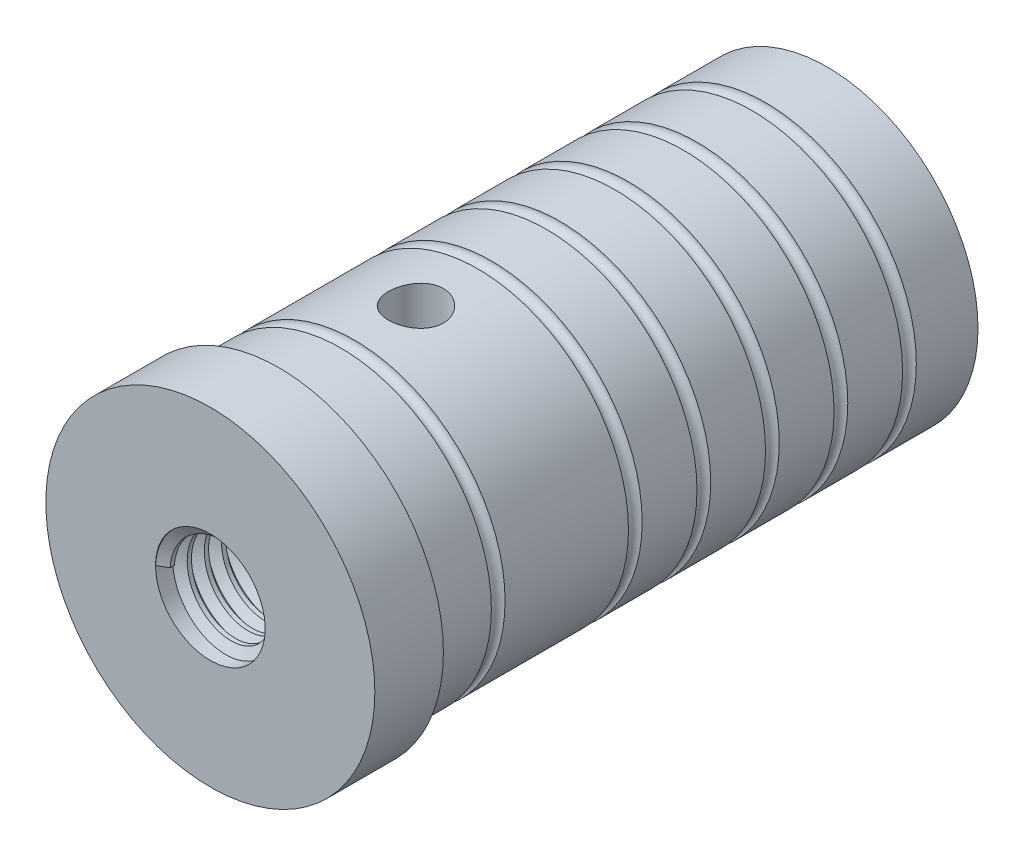
from build123d import *
from build123d.topology import SkipClean

# Parameters (mm, degrees)
IZIM1_R                     = 11
IZIM1_R_2                   = 8
Y_KSEKLIK_EKSTR_ZYON1_DEPTH = 25
IZIM2_R                     = 11
Y_KSEKLIK_EKSTR_ZYON2_DEPTH = 15
IZIM3_R                     = 12
Y_KSEKLIK_EKSTR_ZYON3_DEPTH = 5
IZIM4_R                     = 4
KES_EKSTR_ZYON1_DEPTH       = 89
CUT_EXTRUDE1_DEPTH          = 13
CUT_EXTRUDE1_DEPTH_BACK     = 13
SKETCH1_R                   = 2
SKETCH2_R                   = 0.5
THREAD1_PITCH               = 1.25


with BuildPart() as part:
    # Çizim1 → Yükseklik-Ekstrüzyon1 (new body)
    with BuildSketch(Plane.XY):
        Circle(IZIM1_R)
        Circle(IZIM1_R_2, mode=Mode.SUBTRACT)
    extrude(amount=Y_KSEKLIK_EKSTR_ZYON1_DEPTH)

    # Çizim2 → Yükseklik-Ekstrüzyon2 (add)
    with BuildSketch(Plane.XY.offset(25)):
        Circle(IZIM2_R)
    extrude(amount=Y_KSEKLIK_EKSTR_ZYON2_DEPTH)

    # Çizim3 → Yükseklik-Ekstrüzyon3 (add)
    with BuildSketch(Plane.XY.offset(40)):
        Circle(IZIM3_R)
    extrude(amount=Y_KSEKLIK_EKSTR_ZYON3_DEPTH)

    # Çizim4 → Kes-Ekstrüzyon1 (cut)
    with BuildSketch(Plane.XY.offset(45)):
        Circle(IZIM4_R)
    extrude(amount=-KES_EKSTR_ZYON1_DEPTH, mode=Mode.SUBTRACT)

    # Sketch1 → Cut-Extrude1 (cut, two sides: drawn at the far end of the back side and taken through both)
    with BuildSketch(Plane(origin=(0, 0, 0), x_dir=(1, 0, 0), z_dir=(0, 1, 0)).offset(-CUT_EXTRUDE1_DEPTH_BACK)):
        with Locations(Location((0, -30, 0), (0, 0, 90))):
            Circle(SKETCH1_R)
    extrude(amount=CUT_EXTRUDE1_DEPTH + CUT_EXTRUDE1_DEPTH_BACK, mode=Mode.SUBTRACT)

    # Sketch2 → Cut-Revolve1 (revolve, cut)
    with BuildSketch(Plane(origin=(0, 0, 0), x_dir=(1, 0, 0), z_dir=(0, 1, 0))):
        with Locations((-11, -35)):
            Circle(SKETCH2_R)
        with Locations((-11, -25)):
            Circle(SKETCH2_R)
        with Locations((-11, -20)):
            Circle(SKETCH2_R)
        with Locations((-11, -15)):
            Circle(SKETCH2_R)
        with Locations((-11, -10)):
            Circle(SKETCH2_R)
        with Locations((-11, -5)):
            Circle(SKETCH2_R)
    revolve(axis=Axis((0, 0, 0), (0, 0, 1)), mode=Mode.SUBTRACT)

    # Thread1: the profile of Thread Profile1 profile screwed along a right-hand helix of 16 turns, 8 arcs to a turn; built about Z, then put on its axis
    with SkipClean():  # the faces are left unmerged after this step: merging them gives an invalid solid
        thread1_z = Axis((0, 0, 0), (0, 0, 1))
        thread1_corners = [(4.0003, 0, -0.000173205), (4.0003, 0, 1.093923202), (3.323417656, 0, 0.703124998), (3.323417656, 0, 0.390624998)]
        with BuildLine(mode=Mode.PRIVATE) as thread1_profile:
            Line(thread1_corners[0], thread1_corners[1])
            Line(thread1_corners[1], thread1_corners[2])
            Line(thread1_corners[2], thread1_corners[3])
            Line(thread1_corners[3], thread1_corners[0])
        thread1_cap = Face(thread1_profile.wire())
        thread1_turn_angles = [0, 22.5, 45, 67.5, 90, 112.5, 135, 157.5, 180, 202.5, 225, 247.5, 270, 292.5, 315, 337.5, 360]
        thread1_turn_weights = [1, 0.9238795325112867, 1, 0.9238795325112867, 1, 0.9238795325112867, 1, 0.9238795325112867, 1, 0.9238795325112867, 1, 0.9238795325112867, 1, 0.9238795325112867, 1, 0.9238795325112867, 1]
        thread1_turn_rails = [Edge.make_bspline([Vector(p[0], p[1], 0).rotate(thread1_z, thread1_turn_angles[k]) / thread1_turn_weights[k] + Vector(0, 0, p[2] + THREAD1_PITCH * thread1_turn_angles[k] / 360) for k in range(17)], [0, 0, 0, 1, 1, 2, 2, 3, 3, 4, 4, 5, 5, 6, 6, 7, 7, 8, 8, 8], 2, thread1_turn_weights) for p in thread1_corners]
        thread1_turn_sides = [Face.make_surface_from_curves(thread1_turn_rails[p[0]], thread1_turn_rails[p[1]]) for p in [(0, 1), (1, 2), (2, 3), (3, 0)]]
        thread1 = Plane(origin=(0, 0, 45), x_dir=(-1, 0, 0), z_dir=(0, 0, -1)) * Solid(Shell([*[p.moved(Location((0, 0, THREAD1_PITCH * i))) for i in range(16) for p in thread1_turn_sides], thread1_cap, thread1_cap.rotate(thread1_z, 5760).moved(Location((0, 0, THREAD1_PITCH * 5760 / 360)))]))
        add(thread1)


solid = part.part
